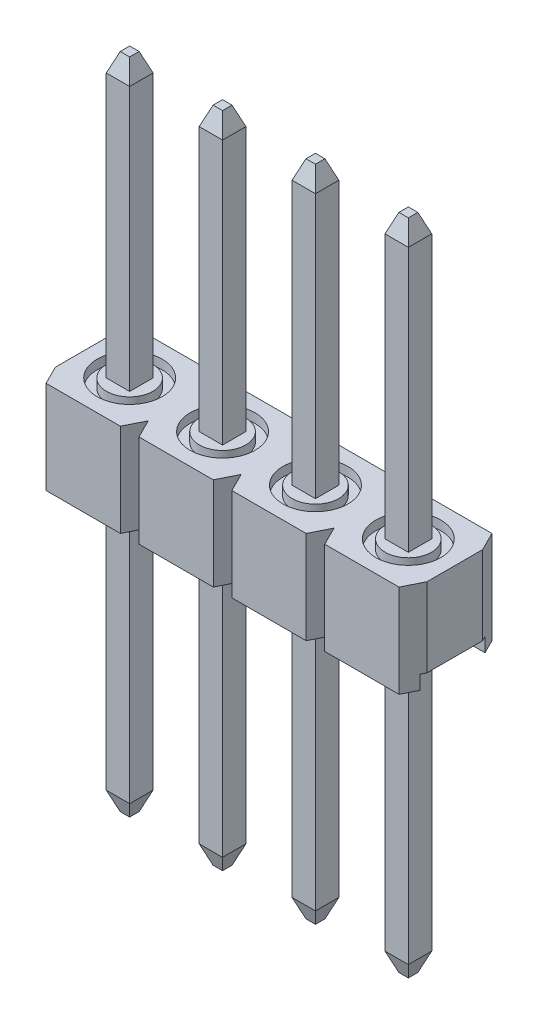
from build123d import *
from OCP.BRepFilletAPI import BRepFilletAPI_MakeChamfer

# Parameters (mm, degrees)
SKETCH1_W                          = 2.54
SKETCH1_H                          = 2.54
MAIN_BODY_DEPTH                    = 2.54
SKETCH3_W                          = 1.778
SKETCH3_H                          = 0.381
CUT_EXTRUDE1_DEPTH                 = 5.399409051
CUT_EXTRUDE2_DEPTH                 = 5.399409051
PIN_START                          = -10.27
SKETCH2_W                          = 0.64
SKETCH2_H                          = 0.64
PIN_DEPTH                          = 18
CHAMFER1_SIZE                      = 0.508
CHAMFER1_SIZE2                     = 0.1905
CHAMFER2_SIZE                      = 0.1905
CHAMFER2_SIZE2                     = 0.508
ESQUISSE1_R                        = 0.889
ESQUISSE1_R_2                      = 0.635
ENL_V_MAT_EXTRU_1_DEPTH            = 0.254
R_P_TITION_START                   = 0.381
R_P_TITION_LIN_AIRE3_DEPTH         = 1.905
R_P_TITION_START_2                 = -7.222
R_P_TITION_LIN_AIRE3_2_OUTLINE_W   = 0.64
R_P_TITION_LIN_AIRE3_2_OUTLINE_H   = 0.64
R_P_TITION_LIN_AIRE3_2_DEPTH       = 16.984
R_P_TITION_START_3                 = 2.286
R_P_TITION_LIN_AIRE3_3_OUTLINE_R   = 0.889
R_P_TITION_LIN_AIRE3_3_OUTLINE_R_2 = 0.635
R_P_TITION_LIN_AIRE3_3_OUTLINE_W   = 0.64
R_P_TITION_LIN_AIRE3_3_OUTLINE_H   = 0.64
R_P_TITION_LIN_AIRE3_3_DEPTH       = 0.254
R_P_TITION_LIN_AIRE3_4_DEPTH       = 0.381


with BuildPart() as part:
    # Sketch1 → Main Body (new body)
    with BuildSketch(Plane(origin=(0, 0, 0), x_dir=(1, 0, 0), z_dir=(0, 1, 0))):
        with Locations((1.27, 1.27)):
            Rectangle(SKETCH1_W, SKETCH1_H)
    extrude(amount=MAIN_BODY_DEPTH)

    # Sketch3 → Cut-Extrude1 (cut, through all)
    with BuildSketch(Plane.ZY):
        with Locations((-1.27, 0.1905)):
            Rectangle(SKETCH3_W, SKETCH3_H)
    extrude(amount=-CUT_EXTRUDE1_DEPTH, mode=Mode.SUBTRACT)

    # Sketch4 → Cut-Extrude2 (cut, through all)
    with BuildSketch(Plane(origin=(0, 2.54, 0), x_dir=(1, 0, 0), z_dir=(0, 1, 0))):
        Polygon((0.254, 2.54), (0, 2.54), (0, 2.032), align=None)
        Polygon((2.54, 2.54), (2.286, 2.54), (2.54, 2.032), align=None)
        Polygon((0.254, 0), (0, 0.508), (0, 0), align=None)
        Polygon((2.54, 0), (2.286, 0), (2.54, 0.508), align=None)
    extrude(amount=-CUT_EXTRUDE2_DEPTH, mode=Mode.SUBTRACT)

    # Sketch2 → Pin (add)
    with BuildSketch(Plane(origin=(0, 2.54, 0), x_dir=(1, 0, 0), z_dir=(0, 1, 0)).offset(PIN_START)):
        with Locations((1.27, 1.27)):
            Rectangle(SKETCH2_W, SKETCH2_H)
    extrude(amount=PIN_DEPTH)

    # Chamfer1: one chamfer whose edges measure the first distance from different faces: ONE call of the kernel's chamfer builder (chamfer() names one face for all edges)
    chamfer1_edges_1 = [part.edges().sort_by_distance(p)[0] for p in [
        (0.95, 10.27, -1.27),
    ]]
    chamfer1_side_1 = [part.faces().sort_by_distance(p)[0] for p in [
        (0.95, 6.405, -1.27),
    ]]
    chamfer1_edges_2 = [part.edges().sort_by_distance(p)[0] for p in [
        (1.27, 10.27, -0.95),
    ]]
    chamfer1_side_2 = [part.faces().sort_by_distance(p)[0] for p in [
        (1.27, 6.405, -0.95),
    ]]
    chamfer1_edges_3 = [part.edges().sort_by_distance(p)[0] for p in [
        (1.59, 10.27, -1.27),
    ]]
    chamfer1_side_3 = [part.faces().sort_by_distance(p)[0] for p in [
        (1.59, 6.405, -1.27),
    ]]
    chamfer1_edges_4 = [part.edges().sort_by_distance(p)[0] for p in [
        (1.27, 10.27, -1.59),
    ]]
    chamfer1_side_4 = [part.faces().sort_by_distance(p)[0] for p in [
        (1.27, 6.405, -1.59),
    ]]
    chamfer1 = BRepFilletAPI_MakeChamfer(part.part.solid().wrapped)
    for e in chamfer1_edges_1:
        chamfer1.Add(CHAMFER1_SIZE, CHAMFER1_SIZE2, e.wrapped, chamfer1_side_1[0].wrapped)  # the first distance lies on this face
    for e in chamfer1_edges_2:
        chamfer1.Add(CHAMFER1_SIZE, CHAMFER1_SIZE2, e.wrapped, chamfer1_side_2[0].wrapped)  # the first distance lies on this face
    for e in chamfer1_edges_3:
        chamfer1.Add(CHAMFER1_SIZE, CHAMFER1_SIZE2, e.wrapped, chamfer1_side_3[0].wrapped)  # the first distance lies on this face
    for e in chamfer1_edges_4:
        chamfer1.Add(CHAMFER1_SIZE, CHAMFER1_SIZE2, e.wrapped, chamfer1_side_4[0].wrapped)  # the first distance lies on this face
    add(Compound.cast(chamfer1.Shape()), mode=Mode.REPLACE)

    # Chamfer2
    chamfer2_edges = [part.edges().sort_by_distance(p)[0] for p in [
        (1.59, -7.73, -1.27),
        (1.27, -7.73, -0.95),
        (0.95, -7.73, -1.27),
        (1.27, -7.73, -1.59),
    ]]
    chamfer2_side = [part.faces().sort_by_distance(p)[0] for p in [
        (1.27, -7.73, -1.27),
    ]]
    chamfer(chamfer2_edges, length=CHAMFER2_SIZE, length2=CHAMFER2_SIZE2, reference=chamfer2_side[0])

    # Esquisse1 → Enlèv. mat.-Extru.1 (cut)
    with BuildSketch(Plane.XZ.offset(-2.54)):
        with Locations(Location((1.27, -1.27, 0), (0, 0, 270))):
            Circle(ESQUISSE1_R)
        with Locations(Location((1.27, -1.27, 0), (0, 0, 270))):
            Circle(ESQUISSE1_R_2, mode=Mode.SUBTRACT)
    extrude(amount=ENL_V_MAT_EXTRU_1_DEPTH, mode=Mode.SUBTRACT)

    # Répétition linéaire3: read off the stored shape, not the designer's step
    # Répétition linéaire3 outline → Répétition linéaire3 (add)
    with BuildSketch(Plane(origin=(0, 0, 0), x_dir=(1, 0, 0), z_dir=(0, 1, 0)).offset(R_P_TITION_START)):
        Polygon((5.334, 0), (7.366, 0), (7.62, 0.508), (7.874, 0), (9.906, 0), (10.16, 0.508), (10.16, 2.032), (9.906, 2.54), (7.874, 2.54), (7.62, 2.032), (7.366, 2.54), (5.334, 2.54), (5.08, 2.032), (4.826, 2.54), (2.794, 2.54), (2.54, 2.032), (2.54, 0.508), (2.794, 0), (4.826, 0), (5.08, 0.508), align=None)
    extrude(amount=R_P_TITION_LIN_AIRE3_DEPTH)

    # R_p_tition lin_aire3 2 outline → R_p_tition lin_aire3 2 (add)
    with BuildSketch(Plane(origin=(0, 0, 0), x_dir=(1, 0, 0), z_dir=(0, 1, 0)).offset(R_P_TITION_START_2)):
        with Locations((3.81, 1.27)):
            Rectangle(R_P_TITION_LIN_AIRE3_2_OUTLINE_W, R_P_TITION_LIN_AIRE3_2_OUTLINE_H)
        with Locations((6.35, 1.27)):
            Rectangle(R_P_TITION_LIN_AIRE3_2_OUTLINE_W, R_P_TITION_LIN_AIRE3_2_OUTLINE_H)
        with Locations((8.89, 1.27)):
            Rectangle(R_P_TITION_LIN_AIRE3_2_OUTLINE_W, R_P_TITION_LIN_AIRE3_2_OUTLINE_H)
    extrude(amount=R_P_TITION_LIN_AIRE3_2_DEPTH)

    # R_p_tition lin_aire3 3 outline → R_p_tition lin_aire3 3 (add)
    # profile 1 of 4: a face of its own
    with BuildSketch(Plane(origin=(0, 0, 0), x_dir=(1, 0, 0), z_dir=(0, 1, 0)).offset(R_P_TITION_START_3)):
        Polygon((5.334, 0), (7.366, 0), (7.62, 0.508), (7.874, 0), (9.906, 0), (10.16, 0.508), (10.16, 2.032), (9.906, 2.54), (7.874, 2.54), (7.62, 2.032), (7.366, 2.54), (5.334, 2.54), (5.08, 2.032), (4.826, 2.54), (2.794, 2.54), (2.54, 2.032), (2.54, 0.508), (2.794, 0), (4.826, 0), (5.08, 0.508), align=None)
        with Locations((3.81, 1.27)):
            Circle(R_P_TITION_LIN_AIRE3_3_OUTLINE_R, mode=Mode.SUBTRACT)
        with Locations((6.35, 1.27)):
            Circle(R_P_TITION_LIN_AIRE3_3_OUTLINE_R, mode=Mode.SUBTRACT)
        with Locations((8.89, 1.27)):
            Circle(R_P_TITION_LIN_AIRE3_3_OUTLINE_R, mode=Mode.SUBTRACT)
    # profile 2 of 4: a face of its own
    with BuildSketch(Plane(origin=(0, 0, 0), x_dir=(1, 0, 0), z_dir=(0, 1, 0)).offset(R_P_TITION_START_3)):
        with Locations((8.89, 1.27)):
            Circle(R_P_TITION_LIN_AIRE3_3_OUTLINE_R_2)
        with Locations((8.89, 1.27)):
            Rectangle(R_P_TITION_LIN_AIRE3_3_OUTLINE_W, R_P_TITION_LIN_AIRE3_3_OUTLINE_H, mode=Mode.SUBTRACT)
    # profile 3 of 4: a face of its own
    with BuildSketch(Plane(origin=(0, 0, 0), x_dir=(1, 0, 0), z_dir=(0, 1, 0)).offset(R_P_TITION_START_3)):
        with Locations((6.35, 1.27)):
            Circle(R_P_TITION_LIN_AIRE3_3_OUTLINE_R_2)
        with Locations((6.35, 1.27)):
            Rectangle(R_P_TITION_LIN_AIRE3_3_OUTLINE_W, R_P_TITION_LIN_AIRE3_3_OUTLINE_H, mode=Mode.SUBTRACT)
    # profile 4 of 4: a face of its own
    with BuildSketch(Plane(origin=(0, 0, 0), x_dir=(1, 0, 0), z_dir=(0, 1, 0)).offset(R_P_TITION_START_3)):
        with Locations((3.81, 1.27)):
            Circle(R_P_TITION_LIN_AIRE3_3_OUTLINE_R_2)
        with Locations((3.81, 1.27)):
            Rectangle(R_P_TITION_LIN_AIRE3_3_OUTLINE_W, R_P_TITION_LIN_AIRE3_3_OUTLINE_H, mode=Mode.SUBTRACT)
    extrude(amount=R_P_TITION_LIN_AIRE3_3_DEPTH)

    # R_p_tition lin_aire3 4 outline → R_p_tition lin_aire3 4 (add)
    with BuildSketch(Plane(origin=(0, 0, 0), x_dir=(1, 0, 0), z_dir=(0, 1, 0))):
        Polygon((5.334, 0), (7.366, 0), (7.5565, 0.381), (5.1435, 0.381), align=None)
        Polygon((5.1435, 2.159), (7.5565, 2.159), (7.366, 2.54), (5.334, 2.54), align=None)
        Polygon((10.0965, 0.381), (7.6835, 0.381), (7.874, 0), (9.906, 0), align=None)
        Polygon((4.826, 0), (5.0165, 0.381), (2.6035, 0.381), (2.794, 0), align=None)
        Polygon((7.6835, 2.159), (10.0965, 2.159), (9.906, 2.54), (7.874, 2.54), align=None)
        Polygon((2.6035, 2.159), (5.0165, 2.159), (4.826, 2.54), (2.794, 2.54), align=None)
    extrude(amount=R_P_TITION_LIN_AIRE3_4_DEPTH)

    # R_p_tition lin_aire3 5: loft between two sections, ruled curve by curve
    r_p_tition_lin_aire3_5_from = [
        Edge.make_line((3.49, -7.222, -0.95), (4.13, -7.222, -0.95)),
        Edge.make_line((4.13, -7.222, -1.59), (3.49, -7.222, -1.59)),
        Edge.make_line((4.13, -7.222, -0.95), (4.13, -7.222, -1.59)),
        Edge.make_line((3.49, -7.222, -0.95), (3.49, -7.222, -1.59)),
    ]
    r_p_tition_lin_aire3_5_to = [
        Edge.make_line((3.6805, -7.73, -1.1405), (3.9395, -7.73, -1.1405)),
        Edge.make_line((3.9395, -7.73, -1.3995), (3.6805, -7.73, -1.3995)),
        Edge.make_line((3.9395, -7.73, -1.1405), (3.9395, -7.73, -1.3995)),
        Edge.make_line((3.6805, -7.73, -1.1405), (3.6805, -7.73, -1.3995)),
    ]
    r_p_tition_lin_aire3_5 = Solid(Shell([*[Face.make_surface_from_curves(r_p_tition_lin_aire3_5_from[k], r_p_tition_lin_aire3_5_to[k]) for k in range(4)], Face(Wire(r_p_tition_lin_aire3_5_from)), Face(Wire(r_p_tition_lin_aire3_5_to))]))
    add(r_p_tition_lin_aire3_5)

    # R_p_tition lin_aire3 6: loft between two sections, ruled curve by curve
    r_p_tition_lin_aire3_6_from = [
        Edge.make_line((6.03, -7.222, -0.95), (6.67, -7.222, -0.95)),
        Edge.make_line((6.67, -7.222, -1.59), (6.03, -7.222, -1.59)),
        Edge.make_line((6.67, -7.222, -0.95), (6.67, -7.222, -1.59)),
        Edge.make_line((6.03, -7.222, -0.95), (6.03, -7.222, -1.59)),
    ]
    r_p_tition_lin_aire3_6_to = [
        Edge.make_line((6.2205, -7.73, -1.1405), (6.4795, -7.73, -1.1405)),
        Edge.make_line((6.4795, -7.73, -1.3995), (6.2205, -7.73, -1.3995)),
        Edge.make_line((6.4795, -7.73, -1.1405), (6.4795, -7.73, -1.3995)),
        Edge.make_line((6.2205, -7.73, -1.1405), (6.2205, -7.73, -1.3995)),
    ]
    r_p_tition_lin_aire3_6 = Solid(Shell([*[Face.make_surface_from_curves(r_p_tition_lin_aire3_6_from[k], r_p_tition_lin_aire3_6_to[k]) for k in range(4)], Face(Wire(r_p_tition_lin_aire3_6_from)), Face(Wire(r_p_tition_lin_aire3_6_to))]))
    add(r_p_tition_lin_aire3_6)

    # R_p_tition lin_aire3 7: loft between two sections, ruled curve by curve
    r_p_tition_lin_aire3_7_from = [
        Edge.make_line((8.57, -7.222, -0.95), (9.21, -7.222, -0.95)),
        Edge.make_line((9.21, -7.222, -1.59), (8.57, -7.222, -1.59)),
        Edge.make_line((9.21, -7.222, -0.95), (9.21, -7.222, -1.59)),
        Edge.make_line((8.57, -7.222, -0.95), (8.57, -7.222, -1.59)),
    ]
    r_p_tition_lin_aire3_7_to = [
        Edge.make_line((8.7605, -7.73, -1.1405), (9.0195, -7.73, -1.1405)),
        Edge.make_line((9.0195, -7.73, -1.3995), (8.7605, -7.73, -1.3995)),
        Edge.make_line((9.0195, -7.73, -1.1405), (9.0195, -7.73, -1.3995)),
        Edge.make_line((8.7605, -7.73, -1.1405), (8.7605, -7.73, -1.3995)),
    ]
    r_p_tition_lin_aire3_7 = Solid(Shell([*[Face.make_surface_from_curves(r_p_tition_lin_aire3_7_from[k], r_p_tition_lin_aire3_7_to[k]) for k in range(4)], Face(Wire(r_p_tition_lin_aire3_7_from)), Face(Wire(r_p_tition_lin_aire3_7_to))]))
    add(r_p_tition_lin_aire3_7)

    # R_p_tition lin_aire3 8: loft between two sections, ruled curve by curve
    r_p_tition_lin_aire3_8_from = [
        Edge.make_line((9.0195, 10.27, -1.3995), (8.7605, 10.27, -1.3995)),
        Edge.make_line((9.0195, 10.27, -1.1405), (8.7605, 10.27, -1.1405)),
        Edge.make_line((9.0195, 10.27, -1.1405), (9.0195, 10.27, -1.3995)),
        Edge.make_line((8.7605, 10.27, -1.3995), (8.7605, 10.27, -1.1405)),
    ]
    r_p_tition_lin_aire3_8_to = [
        Edge.make_line((9.21, 9.762, -1.59), (8.57, 9.762, -1.59)),
        Edge.make_line((9.21, 9.762, -0.95), (8.57, 9.762, -0.95)),
        Edge.make_line((9.21, 9.762, -0.95), (9.21, 9.762, -1.59)),
        Edge.make_line((8.57, 9.762, -1.59), (8.57, 9.762, -0.95)),
    ]
    r_p_tition_lin_aire3_8 = Solid(Shell([*[Face.make_surface_from_curves(r_p_tition_lin_aire3_8_from[k], r_p_tition_lin_aire3_8_to[k]) for k in range(4)], Face(Wire(r_p_tition_lin_aire3_8_from)), Face(Wire(r_p_tition_lin_aire3_8_to))]))
    add(r_p_tition_lin_aire3_8)

    # R_p_tition lin_aire3 9: loft between two sections, ruled curve by curve
    r_p_tition_lin_aire3_9_from = [
        Edge.make_line((6.4795, 10.27, -1.3995), (6.2205, 10.27, -1.3995)),
        Edge.make_line((6.4795, 10.27, -1.1405), (6.2205, 10.27, -1.1405)),
        Edge.make_line((6.4795, 10.27, -1.1405), (6.4795, 10.27, -1.3995)),
        Edge.make_line((6.2205, 10.27, -1.3995), (6.2205, 10.27, -1.1405)),
    ]
    r_p_tition_lin_aire3_9_to = [
        Edge.make_line((6.67, 9.762, -1.59), (6.03, 9.762, -1.59)),
        Edge.make_line((6.67, 9.762, -0.95), (6.03, 9.762, -0.95)),
        Edge.make_line((6.67, 9.762, -0.95), (6.67, 9.762, -1.59)),
        Edge.make_line((6.03, 9.762, -1.59), (6.03, 9.762, -0.95)),
    ]
    r_p_tition_lin_aire3_9 = Solid(Shell([*[Face.make_surface_from_curves(r_p_tition_lin_aire3_9_from[k], r_p_tition_lin_aire3_9_to[k]) for k in range(4)], Face(Wire(r_p_tition_lin_aire3_9_from)), Face(Wire(r_p_tition_lin_aire3_9_to))]))
    add(r_p_tition_lin_aire3_9)

    # R_p_tition lin_aire3 10: loft between two sections, ruled curve by curve
    r_p_tition_lin_aire3_10_from = [
        Edge.make_line((3.9395, 10.27, -1.3995), (3.6805, 10.27, -1.3995)),
        Edge.make_line((3.9395, 10.27, -1.1405), (3.6805, 10.27, -1.1405)),
        Edge.make_line((3.9395, 10.27, -1.1405), (3.9395, 10.27, -1.3995)),
        Edge.make_line((3.6805, 10.27, -1.3995), (3.6805, 10.27, -1.1405)),
    ]
    r_p_tition_lin_aire3_10_to = [
        Edge.make_line((4.13, 9.762, -1.59), (3.49, 9.762, -1.59)),
        Edge.make_line((4.13, 9.762, -0.95), (3.49, 9.762, -0.95)),
        Edge.make_line((4.13, 9.762, -0.95), (4.13, 9.762, -1.59)),
        Edge.make_line((3.49, 9.762, -1.59), (3.49, 9.762, -0.95)),
    ]
    r_p_tition_lin_aire3_10 = Solid(Shell([*[Face.make_surface_from_curves(r_p_tition_lin_aire3_10_from[k], r_p_tition_lin_aire3_10_to[k]) for k in range(4)], Face(Wire(r_p_tition_lin_aire3_10_from)), Face(Wire(r_p_tition_lin_aire3_10_to))]))
    add(r_p_tition_lin_aire3_10)


solid = part.part
